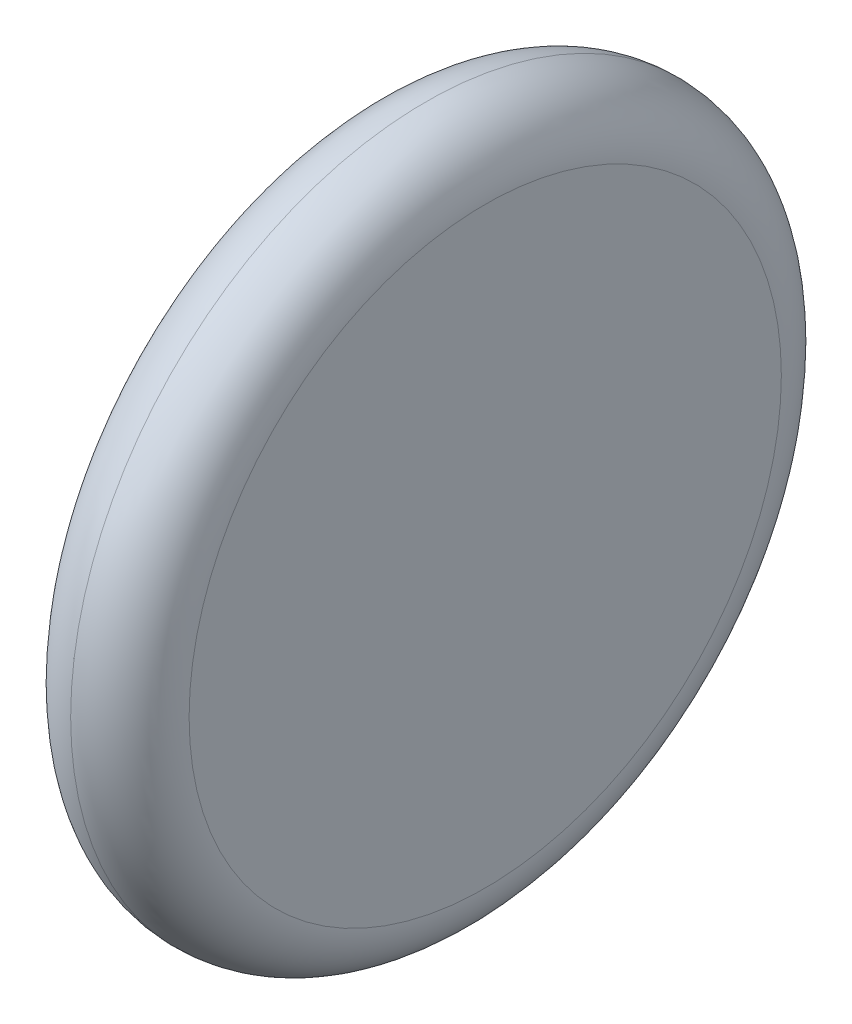
from build123d import *

# Parameters (mm, degrees)
SKETCH_1_R      = 90
EXTRUDE_1_DEPTH = 30
FILLET_1_R      = 15


with BuildPart() as part:
    # 草图1 → 凸台-拉伸1 (new body)
    with BuildSketch(Plane(origin=(0, 0, 0), x_dir=(0, 0, -1), z_dir=(1, 0, 0))):
        Circle(SKETCH_1_R)
    extrude(amount=EXTRUDE_1_DEPTH)

    # 圆角1
    fillet_1_edges = [part.edges().sort_by_distance(p)[0] for p in [
        (0, 0, 90),
        (30, 0, 90),
    ]]
    fillet(fillet_1_edges, radius=FILLET_1_R - 0.0001)  # a hair under: the kernel refuses the full size


solid = part.part
